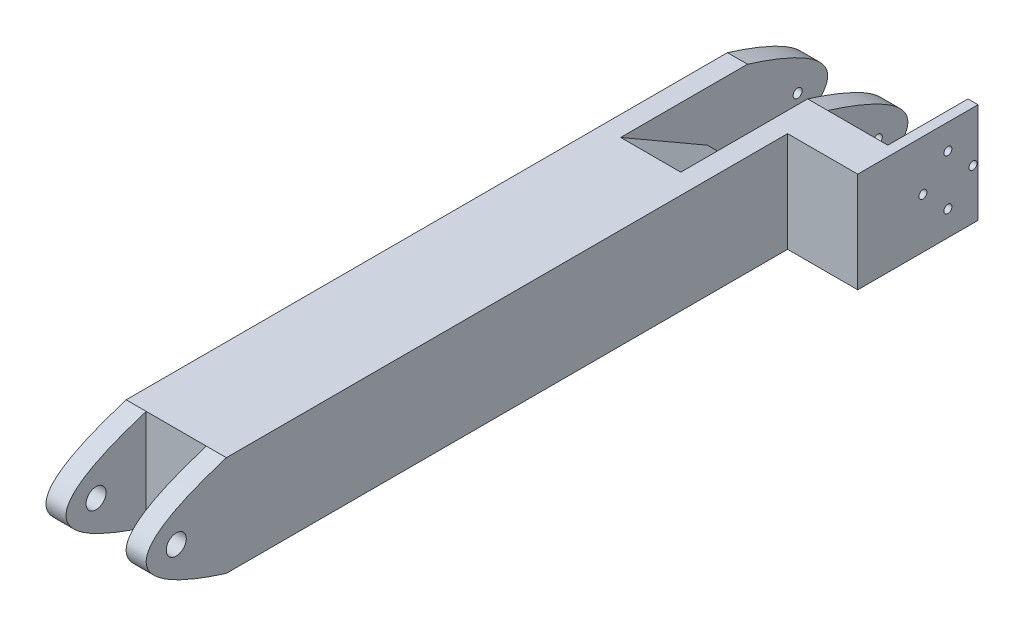
from build123d import *

# Parameters (mm, degrees)
SKETCH1_R               = 5
SKETCH1_R_2             = 2.25
BOSS_EXTRUDE1_DEPTH     = 50
CUT_EXTRUDE1_DEPTH      = 52
CUT_EXTRUDE1_DEPTH_BACK = 35
SKETCH2_W               = 30
SKETCH2_H               = 60
SKETCH3_W               = 30
SKETCH3_H               = 40
CUT_EXTRUDE2_DEPTH      = 52
CUT_EXTRUDE3_START      = -10
CUT_EXTRUDE3_DEPTH      = 30
CUT_EXTRUDE4_START      = -10
CUT_EXTRUDE4_DEPTH      = 30
BOSS_EXTRUDE2_DEPTH     = 50
SKETCH8_R               = 2
CUT_EXTRUDE5_DEPTH      = 10


with BuildPart() as part:
    # Sketch1 → Boss-Extrude1 (new body)
    with BuildSketch(Plane(origin=(0, 0, 0), x_dir=(0, 0, -1), z_dir=(1, 0, 0))):
        with BuildLine():
            Line((-255.87149894, 42.046001407), (44.12850106, 42.046001407))
            add(Edge.make_bspline(
                [(44.12850106, 42.046001407), (124.12850106, 17.046001407), (44.12850106, -7.953998593)],
                knots=[0, 0, 0, 1, 1, 1], degree=2))
            Line((44.12850106, -7.953998593), (-255.87149894, -7.953998593))
            add(Edge.make_bspline(
                [(-255.87149894, 42.046001407), (-335.87149894, 17.046001407), (-255.87149894, -7.953998593)],
                knots=[0, 0, 0, 1, 1, 1], degree=2))
        make_face()
        with Locations((-280.87149894, 17.046001407)):
            Circle(SKETCH1_R, mode=Mode.SUBTRACT)
        with Locations((69.12850106, 17.046001407)):
            Circle(SKETCH1_R_2, mode=Mode.SUBTRACT)
    extrude(amount=BOSS_EXTRUDE1_DEPTH)

    # Sketch2 → Cut-Extrude1 (cut, two sides: drawn at the far end of the back side and taken through both)
    with BuildSketch(Plane(origin=(0, 0, 0), x_dir=(1, 0, 0), z_dir=(0, 1, 0)).offset(-CUT_EXTRUDE1_DEPTH_BACK)):
        with Locations((25, 54.12850106)):
            Rectangle(SKETCH2_W, SKETCH2_H)
    extrude(amount=CUT_EXTRUDE1_DEPTH + CUT_EXTRUDE1_DEPTH_BACK, mode=Mode.SUBTRACT)

    # Sketch3 → Cut-Extrude2 (cut)
    with BuildSketch(Plane.XZ.offset(7.953998593)):
        with Locations((25, 275.87149894)):
            Rectangle(SKETCH3_W, SKETCH3_H)
    extrude(amount=-CUT_EXTRUDE2_DEPTH, mode=Mode.SUBTRACT)

    # Sketch4 → Cut-Extrude3 (cut)
    with BuildSketch(Plane.ZY.offset(CUT_EXTRUDE3_START)):
        Polygon((-24.12850106, 17.046001407), (-24.12850106, 42.046001407), (19.172769129, 42.046001407), align=None)
    extrude(amount=-CUT_EXTRUDE3_DEPTH, mode=Mode.SUBTRACT)

    # Sketch5 → Cut-Extrude4 (cut)
    with BuildSketch(Plane.ZY.offset(CUT_EXTRUDE4_START)):
        Polygon((-24.12850106, -7.953998593), (-24.12850106, 17.046001407), (19.172769129, -7.953998593), align=None)
    extrude(amount=-CUT_EXTRUDE4_DEPTH, mode=Mode.SUBTRACT)

    # Sketch6 → Boss-Extrude2 (add)
    with BuildSketch(Plane(origin=(0, 42.046001407, 0), x_dir=(1, 0, 0), z_dir=(0, 1, 0))):
        Polygon((50, 24.12850106), (85, 24.12850106), (85, 84.12850106), (80, 84.12850106), (80, 44.12850106), (50, 44.12850106), align=None)
    extrude(amount=-BOSS_EXTRUDE2_DEPTH)

    # Sketch8 → Cut-Extrude5 (cut)
    with BuildSketch(Plane(origin=(85, 0, 0), x_dir=(0, 0, -1), z_dir=(1, 0, 0))):
        with Locations((69.12850106, 29.546001407)):
            Circle(SKETCH8_R)
        with Locations((81.62850106, 17.046001407)):
            Circle(SKETCH8_R)
        with Locations((69.12850106, 4.546001407)):
            Circle(SKETCH8_R)
        with Locations((56.62850106, 17.046001407)):
            Circle(SKETCH8_R)
    extrude(amount=-CUT_EXTRUDE5_DEPTH, mode=Mode.SUBTRACT)


solid = part.part
